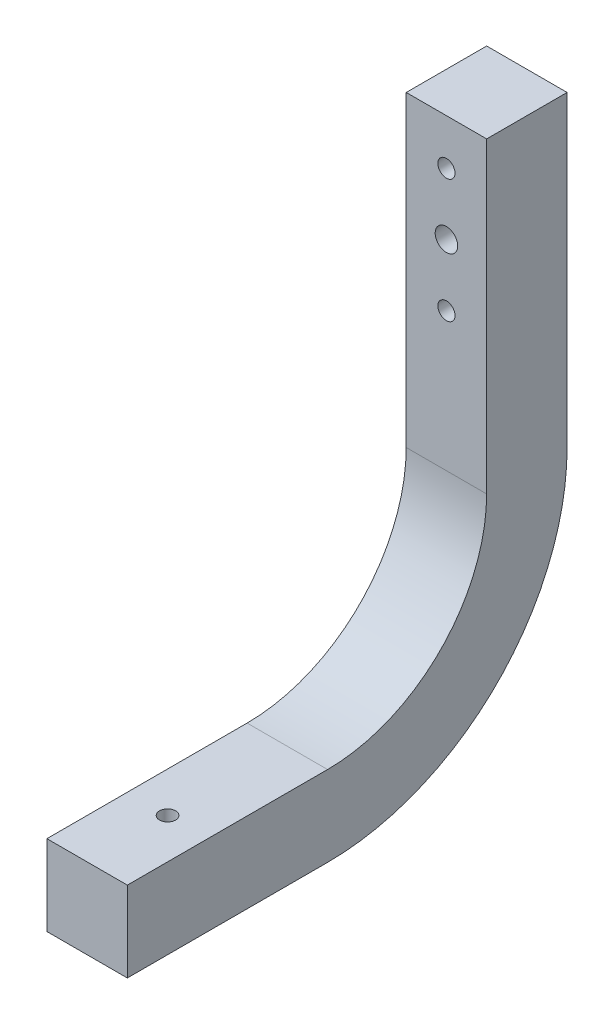
from build123d import *

# Parameters (mm, degrees)
BOSS_EXTRUDE1_DEPTH      = 7.5
BOSS_EXTRUDE1_DEPTH_BACK = 7.5
SKETCH3_R                = 1.5
CUT_EXTRUDE1_DEPTH       = 120.788355027
CUT_EXTRUDE2_DEPTH       = 107.156723763
CUT_EXTRUDE2_DEPTH_BACK  = 107.156723763
SKETCH4_R                = 2.1
SKETCH4_R_2              = 1.6
SKETCH5_R                = 2.275
CUT_EXTRUDE3_DEPTH       = 6
SKETCH6_R                = 3.825
CUT_EXTRUDE4_DEPTH       = 0.75


with BuildPart() as part:
    # Sketch1 → Boss-Extrude1 (new, two sides: drawn at the far end of the back side and taken through both)
    with BuildSketch(Plane(origin=(0, 0, 0), x_dir=(0, 0, -1), z_dir=(1, 0, 0)).offset(-BOSS_EXTRUDE1_DEPTH_BACK)):
        with BuildLine():
            Line((-15, 20), (0, 20))
            Line((0, 20), (0, -37.333333333))
            ThreePointArc((0, -37.333333333), (-13.082563774, -68.917436226), (-44.666666667, -82))
            Line((-44.666666667, -82), (-67, -82))
            Line((-67, -82), (-82, -82))
            Line((-82, -82), (-82, -67))
            Line((-82, -67), (-67, -67))
            Line((-67, -67), (-44.666666667, -67))
            ThreePointArc((-44.666666667, -67), (-23.689165491, -58.310834509), (-15, -37.333333333))
            Line((-15, -37.333333333), (-15, 20))
        make_face()
    extrude(amount=BOSS_EXTRUDE1_DEPTH + BOSS_EXTRUDE1_DEPTH_BACK)

    # Sketch3 → Cut-Extrude1 (cut, through all)
    with BuildSketch(Plane(origin=(0, -67, 0), x_dir=(1, 0, 0), z_dir=(0, 1, 0))):
        with Locations((0, -67)):
            Circle(SKETCH3_R)
    extrude(amount=-CUT_EXTRUDE1_DEPTH, mode=Mode.SUBTRACT)

    # Sketch4 → Cut-Extrude2 (cut, two sides: drawn at the far end of the back side and taken through both)
    with BuildSketch(Plane.XY.offset(15).offset(-CUT_EXTRUDE2_DEPTH_BACK)):
        Circle(SKETCH4_R)
        with Locations((0, 11.5)):
            Circle(SKETCH4_R_2)
        with Locations((0, -11.5)):
            Circle(SKETCH4_R_2)
    extrude(amount=CUT_EXTRUDE2_DEPTH + CUT_EXTRUDE2_DEPTH_BACK, mode=Mode.SUBTRACT)

    # Sketch5 → Cut-Extrude3 (cut)
    with BuildSketch(Plane.XZ.offset(82)):
        with Locations((0, 67)):
            Circle(SKETCH5_R)
    extrude(amount=-CUT_EXTRUDE3_DEPTH, mode=Mode.SUBTRACT)

    # Sketch6 → Cut-Extrude4 (cut)
    with BuildSketch(Plane.XZ.offset(82)):
        with Locations((0, 67)):
            Circle(SKETCH6_R)
    extrude(amount=-CUT_EXTRUDE4_DEPTH, mode=Mode.SUBTRACT)


solid = part.part
